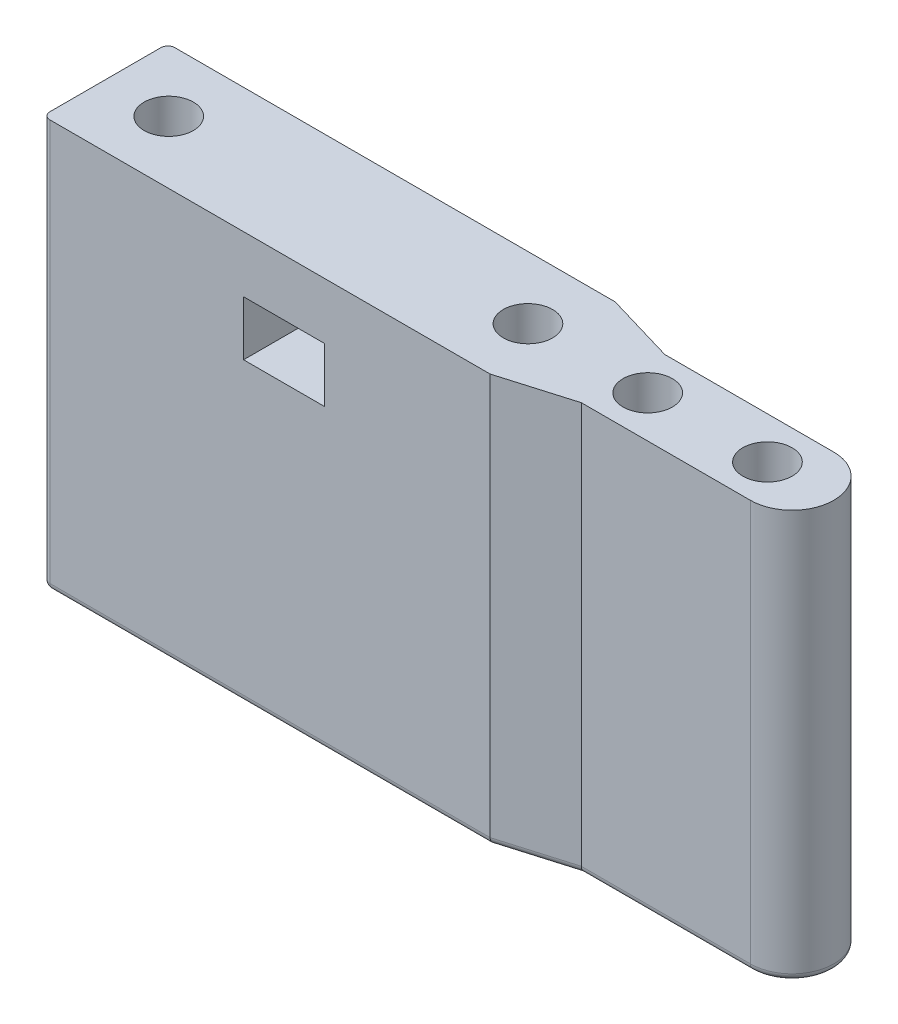
from build123d import *

# Parameters (mm, degrees)
SKETCH1_W                            = 104
SKETCH1_H                            = 58
SKETCH1_W_2                          = 11.5
SKETCH1_H_2                          = 7.75
MODULAR_MAIN_BODY_DEPTH              = 17.75
FRONT_CUT_OUT_DEPTH                  = 107.43853951
SKETCH5_R                            = 3.5
MODULAR_INTERFACE_DEEP_CUT_OUT_DEPTH = 10
FILLET1_R                            = 1
FILLET3_R                            = 1


with BuildPart() as part:
    # Sketch1 → modular_main_body (new body)
    with BuildSketch(Plane.XY):
        with Locations((-35.464851186, 13.154761905)):
            Rectangle(SKETCH1_W, SKETCH1_H)
        with Locations((-53.214851186, 30.279761905)):
            Rectangle(SKETCH1_W_2, SKETCH1_H_2, mode=Mode.SUBTRACT)
    extrude(amount=MODULAR_MAIN_BODY_DEPTH)

    # Sketch2 → front_cut_out (cut, through all)
    with BuildSketch(Plane.XZ.offset(15.845238095)):
        with BuildLine():
            Line((-23.964851186, 17.75), (-13.964851186, 14.8))
            Line((-13.964851186, 14.8), (10.035148814, 14.8))
            ThreePointArc((10.035148814, 14.8), (15.960148814, 8.875), (10.035148814, 2.95))
            Line((10.035148814, 2.95), (-13.964851186, 2.95))
            Line((-13.964851186, 2.95), (-23.964851186, 0))
            Line((-23.964851186, 0), (16.535148814, 0))
            Line((16.535148814, 0), (16.535148814, 17.75))
            Line((16.535148814, 17.75), (-23.964851186, 17.75))
        make_face()
    extrude(amount=-FRONT_CUT_OUT_DEPTH, mode=Mode.SUBTRACT)

    # Sketch5 → modular_interface_deep_cut_out (cut)
    with BuildSketch(Plane(origin=(0, 42.154761905, 0), x_dir=(1, 0, 0), z_dir=(0, 1, 0))):
        with Locations(Location((-78.464851186, -8.875, 0), (0, 0, 180))):
            Circle(SKETCH5_R)
        with Locations(Location((-27.464851186, -8.875, 0), (0, 0, 180))):
            Circle(SKETCH5_R)
        with Locations(Location((-10.464851186, -8.875, 0), (0, 0, 180))):
            Circle(SKETCH5_R)
        with Locations(Location((6.535148814, -8.875, 0), (0, 0, 180))):
            Circle(SKETCH5_R)
    extrude(amount=-MODULAR_INTERFACE_DEEP_CUT_OUT_DEPTH, mode=Mode.SUBTRACT)

    # Fillet1
    fillet1_edges = [part.edges().sort_by_distance(p)[0] for p in [
        (-18.964851186, -15.845238095, 16.275),
        (-1.964851186, -15.845238095, 14.8),
        (15.960148814, -15.845238095, 8.875),
        (-1.964851186, -15.845238095, 2.95),
        (-18.964851186, -15.845238095, 1.475),
        (-55.714851186, -15.845238095, 0),
        (-55.714851186, -15.845238095, 17.75),
        (-87.464851186, -15.845238095, 8.875),
    ]]
    fillet(fillet1_edges, radius=FILLET1_R)

    # Fillet3
    # the kernel refuses this fillet: 1 mm, written as the material it takes off along each edge
    with BuildSketch(Plane(origin=(-86.464851186, -14.845238095, 16.75), x_dir=(0, 0, 1), z_dir=(-1, 0, 0))) as fillet3_piece_1_section:
        Polygon((0, 0), (FILLET3_R, 0), (FILLET3_R, -FILLET3_R), (0, -FILLET3_R), align=None)
    fillet3_piece_1 = extrude(amount=FILLET3_R, mode=Mode.PRIVATE)
    fillet3_piece_1 = fillet3_piece_1 - Plane(origin=(-86.464851186, -14.845238095, 16.75), x_dir=(0, 0.7071067811865475, -0.7071067811865475), z_dir=(-1, 0, 0)) * Sphere(FILLET3_R, mode=Mode.PRIVATE)
    add(fillet3_piece_1, mode=Mode.SUBTRACT)
    with BuildSketch(Plane(origin=(-86.464851186, -14.845238095, 1), x_dir=(-1, 0, 0), z_dir=(0, 0, -1))) as fillet3_piece_2_section:
        Polygon((0, 0), (FILLET3_R, 0), (FILLET3_R, -FILLET3_R), (0, -FILLET3_R), align=None)
    fillet3_piece_2 = extrude(amount=FILLET3_R, mode=Mode.PRIVATE)
    fillet3_piece_2 = fillet3_piece_2 - Plane(origin=(-86.464851186, -14.845238095, 1), x_dir=(0.7071067811865475, 0.7071067811865475, 0), z_dir=(0, 0, -1)) * Sphere(FILLET3_R, mode=Mode.PRIVATE)
    add(fillet3_piece_2, mode=Mode.SUBTRACT)
    with BuildSketch(Plane(origin=(-87.464851186, -14.845238095, 17.75), x_dir=(0, 0, -1), z_dir=(0, 1, 0)), Plane(origin=(-87.464851186, -14.845238095, 0), x_dir=(1, 0, 0), z_dir=(0, 1, 0))) as fillet3_piece_3:
        with BuildLine():
            CenterArc((FILLET3_R, -FILLET3_R), FILLET3_R, 90, 90)
            Line((0, -FILLET3_R), (0, 0))
            Line((0, 0), (FILLET3_R, 0))
        make_face()
    extrude(amount=59.5, mode=Mode.SUBTRACT)


solid = part.part
